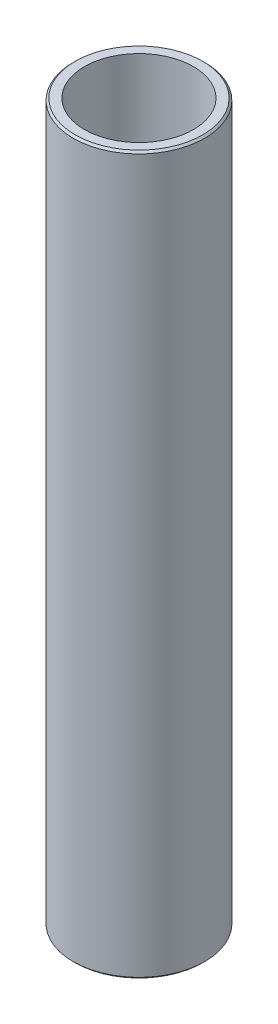
from build123d import *

# Parameters (mm, degrees)
SKETCH1_R           = 55
BOSS_EXTRUDE1_DEPTH = 600
SKETCH2_R           = 45.634933491
CUT_EXTRUDE1_DEPTH  = 606.020660804
CHAMFER1_SIZE       = 1.633490683


with BuildPart() as part:
    # Sketch1 → Boss-Extrude1 (new body)
    with BuildSketch(Plane(origin=(0, 0, 0), x_dir=(1, 0, 0), z_dir=(0, 1, 0))):
        Circle(SKETCH1_R)
    extrude(amount=BOSS_EXTRUDE1_DEPTH)

    # Sketch2 → Cut-Extrude1 (cut, through all)
    with BuildSketch(Plane(origin=(0, 0, 0), x_dir=(1, 0, 0), z_dir=(0, 1, 0))):
        Circle(SKETCH2_R)
    extrude(amount=CUT_EXTRUDE1_DEPTH, mode=Mode.SUBTRACT)

    # Chamfer1
    chamfer1_edges = [part.edges().sort_by_distance(p)[0] for p in [
        (-55, 600, 0),
        (-55, 0, 0),
    ]]
    chamfer(chamfer1_edges, length=CHAMFER1_SIZE)


solid = part.part
